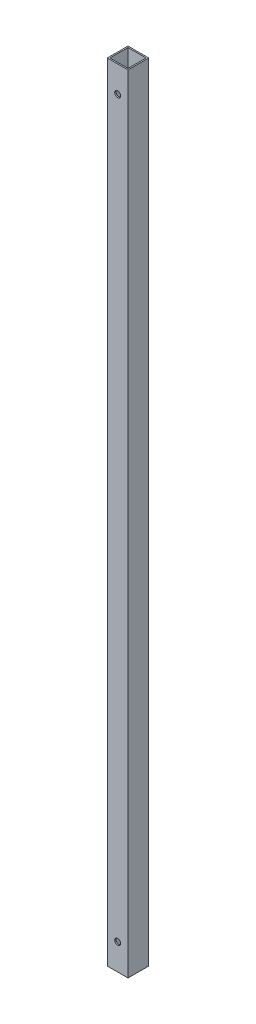
from build123d import *

# Parameters (mm, degrees)
SKETCH1_W           = 15.8
SKETCH1_H           = 15.8
SKETCH1_W_2         = 13.8
SKETCH1_H_2         = 13.8
BOSS_EXTRUDE1_DEPTH = 600
SKETCH3_R           = 2.25
CUT_EXTRUDE2_DEPTH  = 601.25998534


with BuildPart() as part:
    # Sketch1 → Boss-Extrude1 (new body)
    with BuildSketch(Plane(origin=(0, 0, 0), x_dir=(1, 0, 0), z_dir=(0, 1, 0))):
        Rectangle(SKETCH1_W, SKETCH1_H)
        Rectangle(SKETCH1_W_2, SKETCH1_H_2, mode=Mode.SUBTRACT)
    extrude(amount=BOSS_EXTRUDE1_DEPTH)

    # Sketch3 → Cut-Extrude2 (cut, through all)
    with BuildSketch(Plane.XY.offset(7.9)):
        with Locations((0, 580)):
            Circle(SKETCH3_R)
        with Locations((0, 20)):
            Circle(SKETCH3_R)
    extrude(amount=-CUT_EXTRUDE2_DEPTH, mode=Mode.SUBTRACT)


solid = part.part
